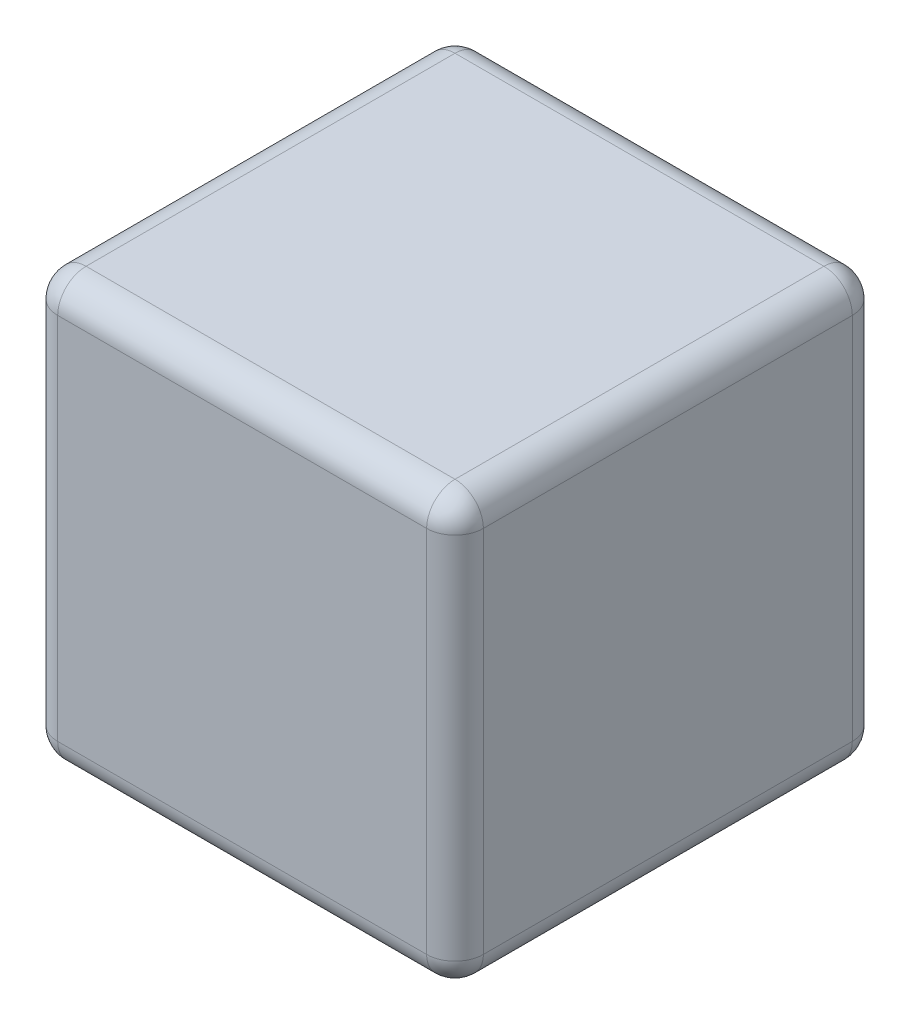
from build123d import *

# Parameters (mm, degrees)
SKETCH1_W           = 38.1
SKETCH1_H           = 38.1
BOSS_EXTRUDE1_DEPTH = 38.1
FILLET1_R           = 2.54


with BuildPart() as part:
    # Sketch1 → Boss-Extrude1 (new body)
    with BuildSketch(Plane(origin=(0, 0, 0), x_dir=(1, 0, 0), z_dir=(0, 1, 0))):
        Rectangle(SKETCH1_W, SKETCH1_H)
    extrude(amount=BOSS_EXTRUDE1_DEPTH)

    # Fillet1
    fillet1_edges = [part.edges().sort_by_distance(p)[0] for p in [
        (-19.05, 0, 0),
        (-19.05, 19.05, -19.05),
        (0, 0, -19.05),
        (19.05, 19.05, -19.05),
        (19.05, 0, 0),
        (-19.05, 38.1, 0),
        (0, 38.1, -19.05),
        (19.05, 38.1, 0),
        (-19.05, 19.05, 19.05),
        (0, 38.1, 19.05),
        (19.05, 19.05, 19.05),
        (0, 0, 19.05),
    ]]
    fillet(fillet1_edges, radius=FILLET1_R)


solid = part.part
